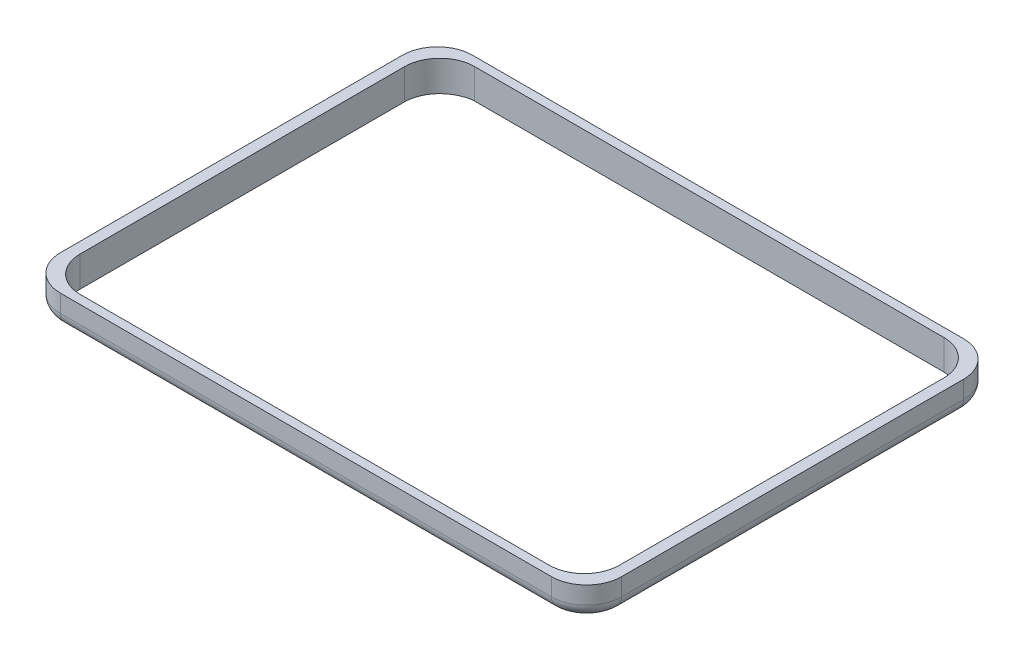
from build123d import *

# Parameters (mm, degrees)
BOSS_EXTRUDE1_DEPTH = 3.5
FILLET2_R           = 1.5


with BuildPart() as part:
    # Sketch1 → Boss-Extrude1 (new body)
    with BuildSketch(Plane(origin=(0, 0, 0), x_dir=(1, 0, 0), z_dir=(0, 1, 0))):
        with BuildLine():
            Line((-28, 23.5), (28, 23.5))
            ThreePointArc((28, 23.5), (30.828427125, 22.328427125), (32, 19.5))
            Line((32, 19.5), (32, -19.5))
            ThreePointArc((32, -19.5), (30.828427125, -22.328427125), (28, -23.5))
            Line((28, -23.5), (-28, -23.5))
            ThreePointArc((-28, -23.5), (-30.828427125, -22.328427125), (-32, -19.5))
            Line((-32, -19.5), (-32, 19.5))
            ThreePointArc((-32, 19.5), (-30.828427125, 22.328427125), (-28, 23.5))
        make_face()
        with BuildLine():
            Line((-26.75, -22.5), (26.75, -22.5))
            ThreePointArc((26.75, -22.5), (29.578427125, -21.328427125), (30.75, -18.5))
            Line((30.75, -18.5), (30.75, 18.5))
            ThreePointArc((30.75, 18.5), (29.578427125, 21.328427125), (26.75, 22.5))
            Line((26.75, 22.5), (-26.75, 22.5))
            ThreePointArc((-26.75, 22.5), (-29.578427125, 21.328427125), (-30.75, 18.5))
            Line((-30.75, 18.5), (-30.75, -18.5))
            ThreePointArc((-30.75, -18.5), (-29.578427125, -21.328427125), (-26.75, -22.5))
        make_face(mode=Mode.SUBTRACT)
    extrude(amount=BOSS_EXTRUDE1_DEPTH)

    # Fillet2
    # the kernel refuses this fillet: 1.5 mm, written as the material it takes off along each edge
    with BuildSketch(Plane(origin=(-28, 0, -19.5), x_dir=(-1, 0, 0), z_dir=(0, 0, 1))) as fillet2_piece_1:
        with BuildLine():
            CenterArc((4 - FILLET2_R, -FILLET2_R), FILLET2_R, 0, 90)
            Line((4 - FILLET2_R, 0), (4, 0))
            Line((4, 0), (4, -FILLET2_R))
        make_face()
    revolve(axis=Axis((-28, 0, -19.5), (0, -1, 0)), revolution_arc=90, mode=Mode.SUBTRACT)
    with BuildSketch(Plane(origin=(28, 0, -19.5), x_dir=(0, 0, -1), z_dir=(-1, 0, 0))) as fillet2_piece_2:
        with BuildLine():
            CenterArc((4 - FILLET2_R, -FILLET2_R), FILLET2_R, 0, 90)
            Line((4 - FILLET2_R, 0), (4, 0))
            Line((4, 0), (4, -FILLET2_R))
        make_face()
    revolve(axis=Axis((28, 0, -19.5), (0, -1, 0)), revolution_arc=90, mode=Mode.SUBTRACT)
    with BuildSketch(Plane(origin=(28, 0, 19.5), x_dir=(1, 0, 0), z_dir=(0, 0, -1))) as fillet2_piece_3:
        with BuildLine():
            CenterArc((4 - FILLET2_R, -FILLET2_R), FILLET2_R, 0, 90)
            Line((4 - FILLET2_R, 0), (4, 0))
            Line((4, 0), (4, -FILLET2_R))
        make_face()
    revolve(axis=Axis((28, 0, 19.5), (0, -1, 0)), revolution_arc=90, mode=Mode.SUBTRACT)
    with BuildSketch(Plane(origin=(-28, 0, 19.5), x_dir=(0, 0, 1), z_dir=(1, 0, 0))) as fillet2_piece_4:
        with BuildLine():
            CenterArc((4 - FILLET2_R, -FILLET2_R), FILLET2_R, 0, 90)
            Line((4 - FILLET2_R, 0), (4, 0))
            Line((4, 0), (4, -FILLET2_R))
        make_face()
    revolve(axis=Axis((-28, 0, 19.5), (0, -1, 0)), revolution_arc=90, mode=Mode.SUBTRACT)
    with BuildSketch(Plane(origin=(28, 0, 23.5), x_dir=(0, 1, 0), z_dir=(-1, 0, 0)), Plane(origin=(-28, 0, -23.5), x_dir=(0, 1, 0), z_dir=(1, 0, 0))) as fillet2_piece_5:
        with BuildLine():
            CenterArc((FILLET2_R, FILLET2_R), FILLET2_R, 180, 90)
            Line((0, FILLET2_R), (0, 0))
            Line((0, 0), (FILLET2_R, 0))
        make_face()
    extrude(amount=56, mode=Mode.SUBTRACT)
    with BuildSketch(Plane(origin=(-32, 0, 19.5), x_dir=(0, 1, 0), z_dir=(0, 0, -1)), Plane(origin=(32, 0, -19.5), x_dir=(0, 1, 0), z_dir=(0, 0, 1))) as fillet2_piece_6:
        with BuildLine():
            CenterArc((FILLET2_R, FILLET2_R), FILLET2_R, 180, 90)
            Line((0, FILLET2_R), (0, 0))
            Line((0, 0), (FILLET2_R, 0))
        make_face()
    extrude(amount=39, mode=Mode.SUBTRACT)


solid = part.part
